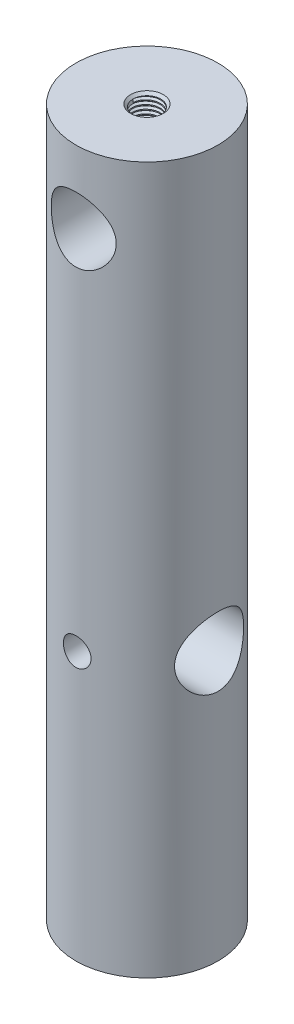
from build123d import *

# Parameters (mm, degrees)
ESBO_O1_R                = 17.5
RESSALTO_EXTRUS_O1_DEPTH = 174
ESBO_O3_R                = 8.5
CORTE_EXTRUS_O1_DEPTH    = 86
ESBO_O15_W               = 3.4
ESBO_O15_H               = 17.5
ESBO_O8_R                = 8
CORTE_EXTRUS_O4_DEPTH    = 86
ROSCA1_PITCH             = 1


# Read off the part's stored shape, not the designer's step: Furo roscado de M81
with BuildPart() as part:
    # Esboço1 → Ressalto-extrusão1 (new body)
    with BuildSketch(Plane(origin=(0, 0, 0), x_dir=(1, 0, 0), z_dir=(0, 1, 0))):
        with Locations(Location((0, 0, 0), (0, 0, 270))):
            Circle(ESBO_O1_R)
    extrude(amount=RESSALTO_EXTRUS_O1_DEPTH)

    # Esboço3 → Corte-extrusão1 (cut, symmetric)
    with BuildSketch(Plane(origin=(0, 0, 0), x_dir=(0, 0, -1), z_dir=(1, 0, 0))):
        with Locations((0, 66)):
            Circle(ESBO_O3_R)
    extrude(amount=CORTE_EXTRUS_O1_DEPTH, both=True, mode=Mode.SUBTRACT)

    # Esboço15 → Furo roscado de M82 (revolve, cut)
    with BuildSketch(Plane(origin=(0, 66, 0), x_dir=(0, 1, 0), z_dir=(1, 0, 0))):
        with Locations((1.7, 8.75)):
            Rectangle(ESBO_O15_W, ESBO_O15_H)
    revolve(axis=Axis((0, 66, -6.35), (0, 0, 1)), mode=Mode.SUBTRACT)

    # Esboço8 → Corte-extrusão4 (cut, symmetric)
    with BuildSketch(Plane.XY):
        with Locations(Location((0, 156, 0), (0, 0, 90))):
            Circle(ESBO_O8_R)
    extrude(amount=CORTE_EXTRUS_O4_DEPTH, both=True, mode=Mode.SUBTRACT)

    # Furo roscado de M81 outline → Furo roscado de M81 (revolve, cut)
    with BuildSketch(Plane.XY):
        Polygon((0, 163.241224668), (3.4, 163.241224668), (3.4, 173.375), (4.025, 174), (0, 174), align=None)
    revolve(axis=Axis((0, 0, 0), (0, 1, 0)), mode=Mode.SUBTRACT)

    # Rosca1: the profile of Perfil da rosca1 profile screwed along a right-hand helix of 10 turns, 8 arcs to a turn; built about Z, then put on its axis
    rosca1_z = Axis((0, 0, 0), (0, 0, 1))
    rosca1_corners = [(3.3997, 0, -0.000173205), (3.941265875, 0, 0.312499999), (3.941265875, 0, 0.437499999), (3.3997, 0, 0.750173202)]
    with BuildLine(mode=Mode.PRIVATE) as rosca1_profile:
        Line(rosca1_corners[0], rosca1_corners[1])
        Line(rosca1_corners[1], rosca1_corners[2])
        Line(rosca1_corners[2], rosca1_corners[3])
        Line(rosca1_corners[3], rosca1_corners[0])
    rosca1_cap = Face(rosca1_profile.wire())
    rosca1_turn_angles = [0, 22.5, 45, 67.5, 90, 112.5, 135, 157.5, 180, 202.5, 225, 247.5, 270, 292.5, 315, 337.5, 360]
    rosca1_turn_weights = [1, 0.9238795325112867, 1, 0.9238795325112867, 1, 0.9238795325112867, 1, 0.9238795325112867, 1, 0.9238795325112867, 1, 0.9238795325112867, 1, 0.9238795325112867, 1, 0.9238795325112867, 1]
    rosca1_turn_rails = [Edge.make_bspline([Vector(p[0], p[1], 0).rotate(rosca1_z, rosca1_turn_angles[k]) / rosca1_turn_weights[k] + Vector(0, 0, p[2] + ROSCA1_PITCH * rosca1_turn_angles[k] / 360) for k in range(17)], [0, 0, 0, 1, 1, 2, 2, 3, 3, 4, 4, 5, 5, 6, 6, 7, 7, 8, 8, 8], 2, rosca1_turn_weights) for p in rosca1_corners]
    rosca1_turn_sides = [Face.make_surface_from_curves(rosca1_turn_rails[p[0]], rosca1_turn_rails[p[1]]) for p in [(0, 1), (1, 2), (2, 3), (3, 0)]]
    rosca1 = Plane(origin=(0, 173.375, 0), x_dir=(-1, 0, 0), z_dir=(0, -1, 0)) * Solid(Shell([*[p.moved(Location((0, 0, ROSCA1_PITCH * i))) for i in range(10) for p in rosca1_turn_sides], rosca1_cap, rosca1_cap.rotate(rosca1_z, 3600).moved(Location((0, 0, ROSCA1_PITCH * 3600 / 360)))]))
    add(rosca1, mode=Mode.SUBTRACT)


solid = part.part
